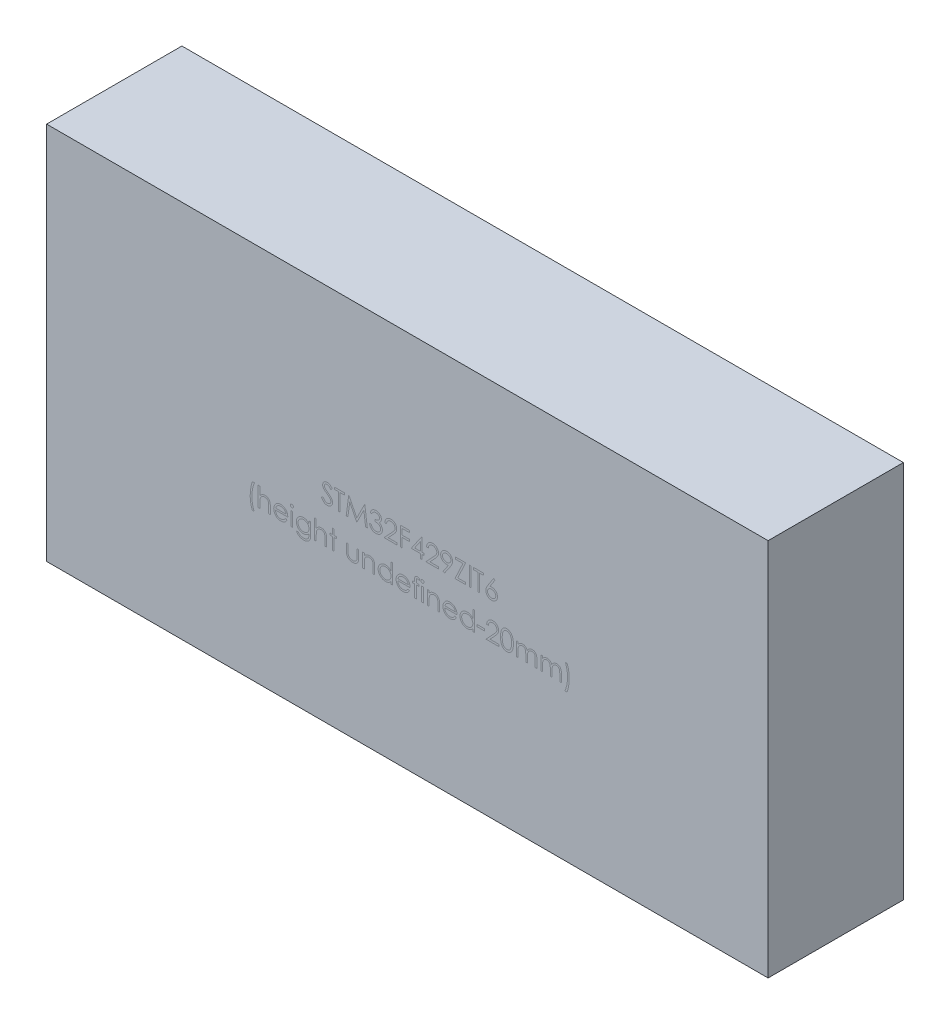
from build123d import *

# Parameters (mm, degrees)
SKETCH_1_W      = 133.34
SKETCH_1_H      = 70
EXTRUDE_1_DEPTH = 25


with BuildPart() as part:
    # 스케치1 → 보스-돌출1 (new body)
    with BuildSketch(Plane.XY):
        Rectangle(SKETCH_1_W, SKETCH_1_H)
    extrude(amount=EXTRUDE_1_DEPTH)


solid = part.part
